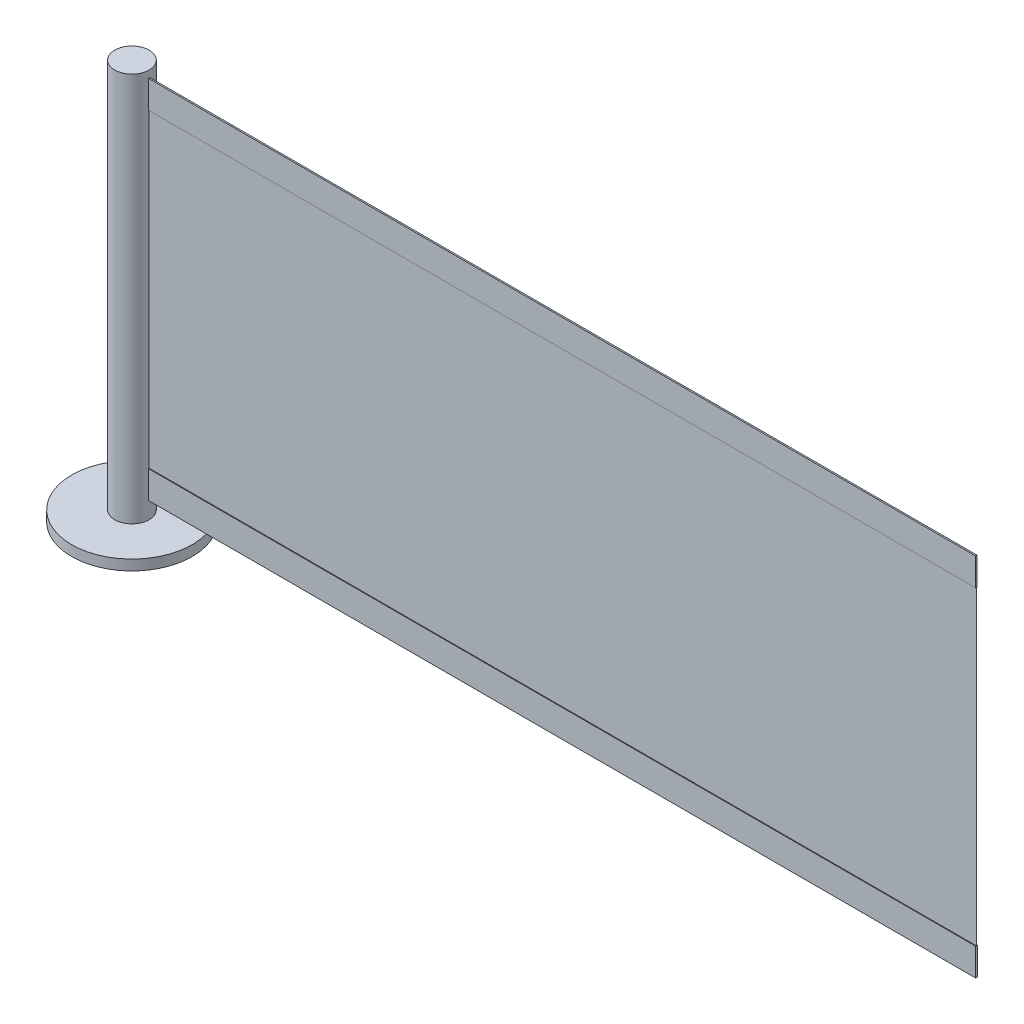
from build123d import *

# Parameters (mm, degrees)
SKETCH2_R           = 175
BOSS_EXTRUDE1_DEPTH = 30
SKETCH3_R           = 50
BOSS_EXTRUDE2_DEPTH = 1110
SKETCH7_W           = 2450
SKETCH7_H           = 1
BOSS_EXTRUDE3_DEPTH = 1060
SKETCH8_W           = 2450
SKETCH8_H           = 4
BOSS_EXTRUDE4_DEPTH = 80
SKETCH11_W          = 2450
SKETCH11_H          = 4.938385514
BOSS_EXTRUDE5_DEPTH = 80
SKETCH12_R          = 50
BOSS_EXTRUDE6_DEPTH = 20


with BuildPart() as part:
    # Sketch2 → Boss-Extrude1 (new body)
    with BuildSketch(Plane(origin=(0, 0, 0), x_dir=(1, 0, 0), z_dir=(0, 1, 0))):
        Circle(SKETCH2_R)
    extrude(amount=BOSS_EXTRUDE1_DEPTH)

    # Sketch3 → Boss-Extrude2 (add)
    with BuildSketch(Plane(origin=(0, 30, 0), x_dir=(1, 0, 0), z_dir=(0, 1, 0))):
        Circle(SKETCH3_R)
    extrude(amount=BOSS_EXTRUDE2_DEPTH)

    # Sketch7 → Boss-Extrude3 (add)
    with BuildSketch(Plane(origin=(0, 1140, 0), x_dir=(1, 0, 0), z_dir=(0, 1, 0))):
        with Locations((1225, 0)):
            Rectangle(SKETCH7_W, SKETCH7_H)
    extrude(amount=-BOSS_EXTRUDE3_DEPTH)

    # Sketch8 → Boss-Extrude4 (add)
    with BuildSketch(Plane(origin=(0, 1140, 0), x_dir=(1, 0, 0), z_dir=(0, 1, 0))):
        with Locations((1225, 0)):
            Rectangle(SKETCH8_W, SKETCH8_H)
    extrude(amount=-BOSS_EXTRUDE4_DEPTH)

    # Sketch11 → Boss-Extrude5 (add)
    with BuildSketch(Plane(origin=(0, 80, 0), x_dir=(-1, 0, 0), z_dir=(0, -1, 0))):
        with Locations((-1225, 0)):
            Rectangle(SKETCH11_W, SKETCH11_H)
    extrude(amount=-BOSS_EXTRUDE5_DEPTH)

    # Sketch12 → Boss-Extrude6 (add)
    with BuildSketch(Plane(origin=(0, 1140, 0), x_dir=(1, 0, 0), z_dir=(0, 1, 0))):
        Circle(SKETCH12_R)
    extrude(amount=BOSS_EXTRUDE6_DEPTH)


solid = part.part
